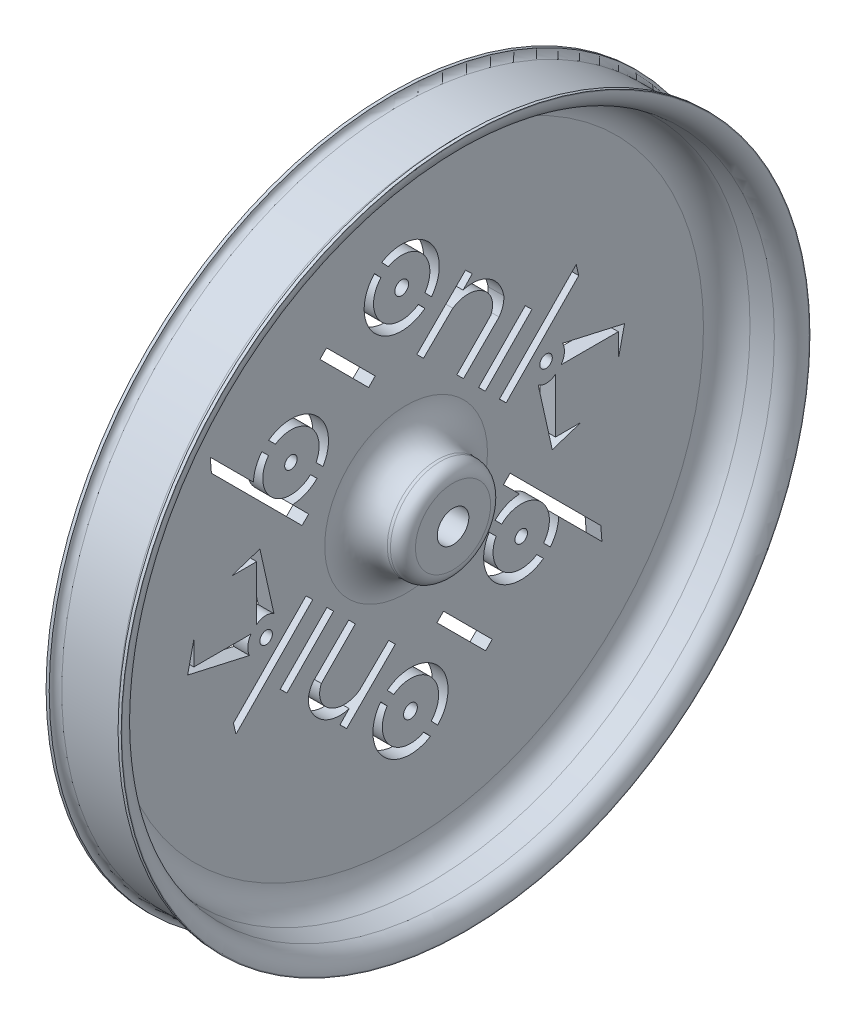
from build123d import *

# Parameters (mm, degrees)
SZKIC4_R                   = 2.525
WYTNIJ_WYCI_GNI_CIE8_DEPTH = 99.235601501
SZKIC5_R                   = 1
SZKIC5_R_2                 = 1.1
WYTNIJ_WYCI_GNI_CIE9_DEPTH = 99.185963366
ZAOKR_GLENIE1_R            = 2
ZAOKR_GLENIE4_R            = 5
SZYK_KO_OWY1_COUNT         = 2


with BuildPart() as part:
    # Szkic1 → Obrót1 (revolve)
    with BuildSketch(Plane.XY):
        with BuildLine():
            Line((7.5, -25.778916817), (-2.5, -25.778916817))
            Line((-2.5, -25.778916817), (-2.5, 29.221083183))
            Line((-2.5, 29.221083183), (-2, 29.221083183))
            Line((-2, 29.221083183), (-2, 29.218308719))
            ThreePointArc((-2, 29.218308719), (-1.707106781, 28.511201938), (-1, 28.218308719))
            Line((-1, 28.218308719), (8, 28.218308719))
            ThreePointArc((8, 28.218308719), (8.707106781, 28.511201938), (9, 29.218308719))
            Line((9, 29.218308719), (9, 29.221083183))
            Line((9, 29.221083183), (9.5, 29.221083183))
            Line((9.5, 29.221083183), (9.5, 29.114299039))
            ThreePointArc((9.5, 29.114299039), (8.757152352, 27.138125145), (6.89649116, 26.140615337))
            Line((6.89649116, 26.140615337), (3.47134512, 25.683929199))
            ThreePointArc((3.47134512, 25.683929199), (0.990463531, 24.353916121), (0, 21.719017596))
            Line((0, 21.719017596), (0, -17.778916817))
            Line((0, -17.778916817), (7.5, -17.778916817))
            Line((7.5, -17.778916817), (7.5, -25.778916817))
        make_face()
    revolve(axis=Axis((7.5, -25.778916817, 0), (-1, 0, 0)))

    # Szkic4 → Wytnij-wyciągnięcie8 (cut, through all)
    with BuildSketch(Plane(origin=(7.5, 0, 0), x_dir=(0, 0, -1), z_dir=(1, 0, 0))):
        with Locations((0, -25.778916817)):
            Circle(SZKIC4_R)
    extrude(amount=-WYTNIJ_WYCI_GNI_CIE8_DEPTH, mode=Mode.SUBTRACT)

    # Szkic5 → Wytnij-wyciągnięcie9 (cut, through all)
    with BuildSketch(Plane(origin=(0, 0, 0), x_dir=(0, 0, -1), z_dir=(1, 0, 0))):
        with Locations((-18.388839437, -11.466671405)):
            Circle(SZKIC5_R)
        with Locations((-0.700011726, 3.849054119)):
            Circle(SZKIC5_R_2)
        with Locations((22.351446627, -17.848177907)):
            Circle(SZKIC5_R)
        with BuildLine():
            Line((-31.094841687, -6.613124119), (-16.615725978, -21.092239828))
            Line((-16.615725978, -21.092239828), (-15.555065806, -20.031579656))
            Line((-15.555065806, -20.031579656), (-18.125745054, -17.460900408))
            ThreePointArc((-18.125745054, -17.460900408), (-16.01586704, -16.97747915), (-14.214823562, -15.776844426))
            Line((-14.214823562, -15.776844426), (-15.27566585, -14.716002138))
            ThreePointArc((-15.27566585, -14.716002138), (-21.387422035, -14.822040596), (-21.966266492, -8.736833375))
            Line((-21.966266492, -8.736833375), (-23.034055299, -7.669044568))
            ThreePointArc((-23.034055299, -7.669044568), (-23.994432776, -9.327203406), (-24.38306844, -11.203577022))
            Line((-24.38306844, -11.203577022), (-31.277426391, -4.309219071))
            Line((-31.277426391, -4.309219071), (-31.094841687, -6.613124119))
        make_face()
        Polygon((-13.762623938, 0.462745665), (-12.701963767, 1.523405837), (-4.923789174, -6.254768757), (-5.984449345, -7.315428928), align=None)
        with BuildLine():
            Line((2.777823766, -7.658526292), (1.717163594, -6.597866121))
            Line((1.717163594, -6.597866121), (9.495338187, 1.180308472))
            Line((9.495338187, 1.180308472), (10.570018386, 0.133856146))
            Line((10.570018386, 0.133856146), (9.092674077, -1.383339271))
            ThreePointArc((9.092674077, -1.383339271), (13.266335097, -1.934512068), (15.610113794, -5.431645063))
            ThreePointArc((15.610113794, -5.431645063), (15.454216267, -6.774350594), (14.851569634, -7.984300683))
            Line((14.851569634, -7.984300683), (9.16797181, -13.667898507))
            Line((9.16797181, -13.667898507), (8.107311638, -12.607238335))
            Line((8.107311638, -12.607238335), (13.531289778, -7.083155107))
            ThreePointArc((13.531289778, -7.083155107), (13.755364684, -5.204613003), (12.856866184, -3.539731492))
            ThreePointArc((12.856866184, -3.539731492), (10.244628749, -2.348660318), (7.466378572, -3.072373603))
            Line((7.466378572, -3.072373603), (2.777823766, -7.658526292))
        make_face()
        Polygon((19.034204321, -8.50770115), (20.104518041, -9.558619101), (12.651151004, -17.149545682), (11.580837283, -16.098627732), align=None)
        Polygon((14.909999771, -19.367460552), (27.173004637, -6.878129336), (27.57133674, -8.613431014), (15.980313491, -20.418378503), align=None)
        with BuildLine():
            Line((25.017895383, -16.692349683), (34.890895944, -18.91825075))
            Line((34.890895944, -18.91825075), (33.893395016, -23.342673454))
            Line((33.893395016, -23.342673454), (33.893395016, -19.540337611))
            Line((33.893395016, -19.540337611), (24.76065193, -19.540337611))
            ThreePointArc((24.76065193, -19.540337611), (25.276488263, -18.151318663), (25.017895383, -16.692349683))
        make_face()
        with BuildLine():
            Line((21.102547463, -20.521464819), (23.349890256, -30.595343288))
            Line((23.349890256, -30.595343288), (27.925501355, -29.098609188))
            Line((27.925501355, -29.098609188), (23.865039811, -29.098609188))
            Line((23.865039811, -29.098609188), (23.865039811, -20.39214657))
            ThreePointArc((23.865039811, -20.39214657), (22.505330451, -20.916874434), (21.102547463, -20.521464819))
        make_face()
        with BuildLine():
            Line((-13.271360049, -14.598987595), (-14.373050639, -13.497297005))
            ThreePointArc((-14.373050639, -13.497297005), (-15.396196984, -8.106003146), (-20.869569347, -7.712210177))
            Line((-20.869569347, -7.712210177), (-21.946541948, -6.635237576))
            ThreePointArc((-21.946541948, -6.635237576), (-14.331308837, -7.046666266), (-13.271360049, -14.598987595))
        make_face()
        with BuildLine():
            Line((-2.824040128, 7.816232379), (-3.888175064, 8.931928751))
            ThreePointArc((-3.888175064, 8.931928751), (3.737293337, 7.887658306), (4.061143089, 0.197834483))
            Line((4.061143089, 0.197834483), (3.00903432, 1.300921974))
            ThreePointArc((3.00903432, 1.300921974), (2.65265701, 6.85065575), (-2.824040128, 7.816232379))
        make_face()
        with BuildLine():
            Line((-4.015299992, 6.89189222), (-5.052299234, 7.97913807))
            ThreePointArc((-5.052299234, 7.97913807), (-5.136070021, -0.190919494), (3.006195703, -0.869423018))
            Line((3.006195703, -0.869423018), (1.964521099, 0.222724732))
            ThreePointArc((1.964521099, 0.222724732), (-4.050432507, 0.844943504), (-4.015299992, 6.89189222))
        make_face()
    wytnij_wyci_gni_cie9 = extrude(amount=-WYTNIJ_WYCI_GNI_CIE9_DEPTH, mode=Mode.SUBTRACT)

    # Zaokrąglenie1
    zaokr_glenie1_edges = [part.edges().sort_by_distance(p)[0] for p in [
        (7.5, -33.778916817, 0),
    ]]
    fillet(zaokr_glenie1_edges, radius=ZAOKR_GLENIE1_R)

    # Zaokrąglenie4
    zaokr_glenie4_edges = [part.edges().sort_by_distance(p)[0] for p in [
        (0, -33.778916817, 0),
    ]]
    fillet(zaokr_glenie4_edges, radius=ZAOKR_GLENIE4_R)

    # Szyk kołowy1: Wytnij-wyciągnięcie9 ×2 about axis
    szyk_ko_owy1_axis = Axis((-2.5, -25.778916817, 0), (1, 0, 0))
    for i in range(1, SZYK_KO_OWY1_COUNT):
        add(wytnij_wyci_gni_cie9.rotate(szyk_ko_owy1_axis, i * 360 / SZYK_KO_OWY1_COUNT), mode=Mode.SUBTRACT)


solid = part.part
